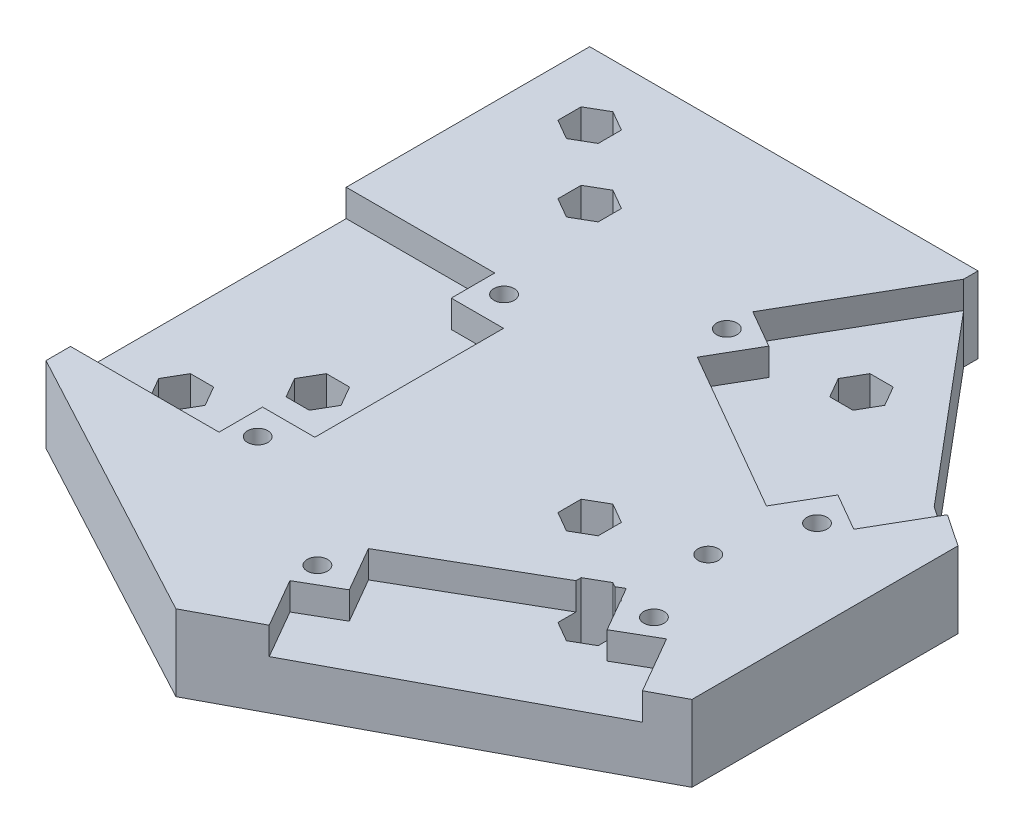
from build123d import *

# Parameters (mm, degrees)
SKETCH1_W               = 100
SKETCH1_H               = 100
BOSS_EXTRUDE1_DEPTH     = 14
SKETCH1_3_R             = 2.15
SKETCH1_3_R_2           = 2.2
BOSS_EXTRUDE2_DEPTH     = 3
BOSS_EXTRUDE3_OUTLINE_R = 1.876672924
BOSS_EXTRUDE3_DEPTH     = 14
SKETCH2_4_R             = 1.876672924
SKETCH2_4_R_2           = 1.876681549
SKETCH2_4_R_3           = 1.876676308
CUT_EXTRUDE2_DEPTH      = 102.168534459
SKETCH1_5_R             = 2.15
SKETCH1_5_R_2           = 2.2
CUT_EXTRUDE3_DEPTH      = 102.168534459
CUT_EXTRUDE4_START      = 3
SKETCH1_6_R             = 2.15
SKETCH1_6_R_2           = 2.2
CUT_EXTRUDE4_DEPTH      = 99.168534459
SKETCH4_R               = 3.5
CUT_EXTRUDE5_DEPTH      = 7
CUT_EXTRUDE6_START      = -5
CUT_EXTRUDE6_DEPTH      = 5
CUT_EXTRUDE7_DEPTH      = 102.168534459


# Read off the part's stored shape, not the designer's step: Boss-Extrude3, Cut-Extrude6
with BuildPart() as part:
    # Sketch1 → Boss-Extrude1 (new body)
    with BuildSketch(Plane(origin=(0, 0, 0), x_dir=(1, 0, 0), z_dir=(0, 1, 0))):
        Rectangle(SKETCH1_W, SKETCH1_H)
        Polygon((28.7, -27.136195996), (28.7, -22.863804004), (25, -20.727608008), (21.3, -22.863804004), (21.3, -27.136195996), (25, -29.272391992), align=None, mode=Mode.SUBTRACT)
        Polygon((27.136195996, 28.7), (22.863804004, 28.7), (20.727608008, 25), (22.863804004, 21.3), (27.136195996, 21.3), (29.272391992, 25), align=None, mode=Mode.SUBTRACT)
        Polygon((39.636195996, 33.8), (41.772391992, 37.5), (39.636195996, 41.2), (35.363804004, 41.2), (33.227608008, 37.5), (35.363804004, 33.8), align=None, mode=Mode.SUBTRACT)
        Polygon((33.8, -39.636195996), (37.5, -41.772391992), (41.2, -39.636195996), (41.2, -35.363804004), (37.5, -33.227608008), (33.8, -35.363804004), align=None, mode=Mode.SUBTRACT)
        Polygon((-27.136195996, -28.7), (-22.863804004, -28.7), (-20.727608008, -25), (-22.863804004, -21.3), (-27.136195996, -21.3), (-29.272391992, -25), align=None, mode=Mode.SUBTRACT)
        Polygon((-39.636195996, -33.8), (-41.772391992, -37.5), (-39.636195996, -41.2), (-35.363804004, -41.2), (-33.227608008, -37.5), (-35.363804004, -33.8), align=None, mode=Mode.SUBTRACT)
        Polygon((-28.7, 27.136195996), (-28.7, 22.863804004), (-25, 20.727608008), (-21.3, 22.863804004), (-21.3, 27.136195996), (-25, 29.272391992), align=None, mode=Mode.SUBTRACT)
        Polygon((-33.8, 39.636195996), (-37.5, 41.772391992), (-41.2, 39.636195996), (-41.2, 35.363804004), (-37.5, 33.227608008), (-33.8, 35.363804004), align=None, mode=Mode.SUBTRACT)
    extrude(amount=BOSS_EXTRUDE1_DEPTH)

    # Sketch1<3> → Boss-Extrude2 (add)
    # profile 1 of 8: a face of its own
    with BuildSketch(Plane(origin=(0, 0, 0), x_dir=(1, 0, 0), z_dir=(0, 1, 0))):
        Polygon((-21.3, 27.136195996), (-25, 29.272391992), (-28.7, 27.136195996), (-28.7, 22.863804004), (-25, 20.727608008), (-21.3, 22.863804004), align=None)
        with Locations(Location((-25, 25, 0), (0, 0, 270))):
            Circle(SKETCH1_3_R, mode=Mode.SUBTRACT)
    # profile 2 of 8: a face of its own
    with BuildSketch(Plane(origin=(0, 0, 0), x_dir=(1, 0, 0), z_dir=(0, 1, 0))):
        Polygon((27.136195996, 21.3), (29.272391992, 25), (27.136195996, 28.7), (22.863804004, 28.7), (20.727608008, 25), (22.863804004, 21.3), align=None)
        with Locations(Location((25, 25, 0), (0, 0, 270))):
            Circle(SKETCH1_3_R, mode=Mode.SUBTRACT)
    # profile 3 of 8: a face of its own
    with BuildSketch(Plane(origin=(0, 0, 0), x_dir=(1, 0, 0), z_dir=(0, 1, 0))):
        Polygon((-27.136195996, -21.3), (-29.272391992, -25), (-27.136195996, -28.7), (-22.863804004, -28.7), (-20.727608008, -25), (-22.863804004, -21.3), align=None)
        with Locations(Location((-25, -25, 0), (0, 0, 270))):
            Circle(SKETCH1_3_R, mode=Mode.SUBTRACT)
    # profile 4 of 8: a face of its own
    with BuildSketch(Plane(origin=(0, 0, 0), x_dir=(1, 0, 0), z_dir=(0, 1, 0))):
        Polygon((21.3, -27.136195996), (25, -29.272391992), (28.7, -27.136195996), (28.7, -22.863804004), (25, -20.727608008), (21.3, -22.863804004), align=None)
        with Locations(Location((25, -25, 0), (0, 0, 270))):
            Circle(SKETCH1_3_R, mode=Mode.SUBTRACT)
    # profile 5 of 8: a face of its own
    with BuildSketch(Plane(origin=(0, 0, 0), x_dir=(1, 0, 0), z_dir=(0, 1, 0))):
        Polygon((-37.5, 33.227608008), (-33.8, 35.363804004), (-33.8, 39.636195996), (-37.5, 41.772391992), (-41.2, 39.636195996), (-41.2, 35.363804004), align=None)
        with Locations(Location((-37.5, 37.5, 0), (0, 0, 270))):
            Circle(SKETCH1_3_R_2, mode=Mode.SUBTRACT)
    # profile 6 of 8: a face of its own
    with BuildSketch(Plane(origin=(0, 0, 0), x_dir=(1, 0, 0), z_dir=(0, 1, 0))):
        Polygon((33.227608008, 37.5), (35.363804004, 33.8), (39.636195996, 33.8), (41.772391992, 37.5), (39.636195996, 41.2), (35.363804004, 41.2), align=None)
        with Locations(Location((37.5, 37.5, 0), (0, 0, 270))):
            Circle(SKETCH1_3_R_2, mode=Mode.SUBTRACT)
    # profile 7 of 8: a face of its own
    with BuildSketch(Plane(origin=(0, 0, 0), x_dir=(1, 0, 0), z_dir=(0, 1, 0))):
        Polygon((37.5, -33.227608008), (33.8, -35.363804004), (33.8, -39.636195996), (37.5, -41.772391992), (41.2, -39.636195996), (41.2, -35.363804004), align=None)
        with Locations(Location((37.5, -37.5, 0), (0, 0, 270))):
            Circle(SKETCH1_3_R_2, mode=Mode.SUBTRACT)
    # profile 8 of 8: a face of its own
    with BuildSketch(Plane(origin=(0, 0, 0), x_dir=(1, 0, 0), z_dir=(0, 1, 0))):
        Polygon((-33.227608008, -37.5), (-35.363804004, -33.8), (-39.636195996, -33.8), (-41.772391992, -37.5), (-39.636195996, -41.2), (-35.363804004, -41.2), align=None)
        with Locations(Location((-37.5, -37.5, 0), (0, 0, 270))):
            Circle(SKETCH1_3_R_2, mode=Mode.SUBTRACT)
    extrude(amount=BOSS_EXTRUDE2_DEPTH)

    # Boss-Extrude3 outline → Boss-Extrude3 (add)
    # profile 1 of 3: a face of its own
    with BuildSketch(Plane(origin=(0, 0, 0), x_dir=(1, 0, 0), z_dir=(0, 1, 0))):
        Polygon((-50, -50), (1.49030732, -77.596125408), (63.387015123, -44.578572147), (63.387015123, 4.360488441), (50, 13.368548372), (50, -50), align=None)
        with Locations((7.56996484, -57.649113785)):
            Circle(BOSS_EXTRUDE3_OUTLINE_R, mode=Mode.SUBTRACT)
    # profile 2 of 3: a face of its own
    with BuildSketch(Plane(origin=(0, 0, 0), x_dir=(1, 0, 0), z_dir=(0, 1, 0))):
        Polygon((33.8, -35.363804004), (33.8, -39.636195996), (37.5, -41.772391992), (41.2, -39.636195996), (41.2, -35.363804004), (37.5, -33.227608008), align=None)
    # profile 3 of 3: a face of its own
    with BuildSketch(Plane(origin=(0, 0, 0), x_dir=(1, 0, 0), z_dir=(0, 1, 0))):
        Polygon((25, -29.272391992), (28.7, -27.136195996), (28.7, -22.863804004), (25, -20.727608008), (21.3, -22.863804004), (21.3, -27.136195996), align=None)
    extrude(amount=BOSS_EXTRUDE3_DEPTH)

    # Sketch2<4> → Cut-Extrude2 (cut, through all)
    with BuildSketch(Plane(origin=(0, 0, 0), x_dir=(1, 0, 0), z_dir=(0, 1, 0))):
        with Locations(Location((-18.410804318, 2.661766915, 0), (0, 0, 90))):
            Circle(SKETCH2_4_R)
        with Locations(Location((-18.410857492, -42.64912664, 0), (0, 0, 90))):
            Circle(SKETCH2_4_R_2)
        with Locations(Location((46.810335072, -4.993667335, 0), (0, 0, 90))):
            Circle(SKETCH2_4_R)
        with Locations(Location((7.569976773, 17.661825492, 0), (0, 0, 90))):
            Circle(SKETCH2_4_R_2)
        with Locations(Location((46.810376313, -34.993713059, 0), (0, 0, 90))):
            Circle(SKETCH2_4_R_2)
        with Locations(Location((41.81037924, -19.993681351, 0), (0, 0, 90))):
            Circle(SKETCH2_4_R_3)
    extrude(amount=CUT_EXTRUDE2_DEPTH, mode=Mode.SUBTRACT)

    # Sketch1<5> → Cut-Extrude3 (cut, through all)
    with BuildSketch(Plane(origin=(0, 0, 0), x_dir=(1, 0, 0), z_dir=(0, 1, 0))):
        with Locations(Location((25, -25, 0), (0, 0, 90))):
            Circle(SKETCH1_5_R)
        with Locations(Location((37.5, -37.5, 0), (0, 0, 90))):
            Circle(SKETCH1_5_R_2)
    extrude(amount=CUT_EXTRUDE3_DEPTH, mode=Mode.SUBTRACT)

    # Sketch1<6> → Cut-Extrude4 (cut, through all)
    # profile 1 of 2: a face of its own
    with BuildSketch(Plane(origin=(0, 0, 0), x_dir=(1, 0, 0), z_dir=(0, 1, 0)).offset(CUT_EXTRUDE4_START)):
        Polygon((21.3, -27.136195996), (25, -29.272391992), (28.7, -27.136195996), (28.7, -22.863804004), (25, -20.727608008), (21.3, -22.863804004), align=None)
        with Locations(Location((25, -25, 0), (0, 0, 90))):
            Circle(SKETCH1_6_R, mode=Mode.SUBTRACT)
    # profile 2 of 2: a face of its own
    with BuildSketch(Plane(origin=(0, 0, 0), x_dir=(1, 0, 0), z_dir=(0, 1, 0)).offset(CUT_EXTRUDE4_START)):
        Polygon((37.5, -33.227608008), (33.8, -35.363804004), (33.8, -39.636195996), (37.5, -41.772391992), (41.2, -39.636195996), (41.2, -35.363804004), align=None)
        with Locations(Location((37.5, -37.5, 0), (0, 0, 90))):
            Circle(SKETCH1_6_R_2, mode=Mode.SUBTRACT)
    extrude(amount=CUT_EXTRUDE4_DEPTH, mode=Mode.SUBTRACT)

    # Sketch4 → Cut-Extrude5 (cut)
    with BuildSketch(Plane.XZ):
        with Locations(Location((-18.410857492, 42.64912664, 0), (0, 0, 270))):
            Circle(SKETCH4_R)
        with Locations(Location((7.56996484, 57.649113785, 0), (0, 0, 270))):
            Circle(SKETCH4_R)
        with Locations(Location((46.810376313, 34.993713059, 0), (0, 0, 270))):
            Circle(SKETCH4_R)
        with Locations(Location((41.81037924, 19.993681351, 0), (0, 0, 270))):
            Circle(SKETCH4_R)
        with Locations(Location((46.810335072, 4.993667335, 0), (0, 0, 270))):
            Circle(SKETCH4_R)
        with Locations(Location((7.569976773, -17.661825492, 0), (0, 0, 270))):
            Circle(SKETCH4_R)
        with Locations(Location((-18.410804318, -2.661766915, 0), (0, 0, 270))):
            Circle(SKETCH4_R)
    extrude(amount=-CUT_EXTRUDE5_DEPTH, mode=Mode.SUBTRACT)

    # Cut-Extrude6 outline → Cut-Extrude6 (cut)
    # profile 1 of 4: a face of its own
    with BuildSketch(Plane(origin=(0, 14, 0), x_dir=(1, 0, 0), z_dir=(0, 1, 0)).offset(CUT_EXTRUDE6_START)):
        Polygon((33.8, -39.636195996), (33.8, -36.323061379), (9.605859336, -50.29154546), (14.416411925, -58.623672649), (7.488236991, -62.623721659), (12.684960133, -71.624563129), (57.455635846, -47.742547068), (51.407399943, -37.26690995), (44.479232222, -41.266971454), (41.2, -35.587170755), (41.2, -39.636195996), (37.5, -41.772391992), align=None)
    # profile 2 of 4: a face of its own
    with BuildSketch(Plane(origin=(0, 14, 0), x_dir=(1, 0, 0), z_dir=(0, 1, 0)).offset(CUT_EXTRUDE6_START)):
        Polygon((38.330742803, -33.707237589), (41.006558917, -35.252120743), (39.668651775, -32.934796012), align=None)
    # profile 3 of 4: a face of its own
    with BuildSketch(Plane(origin=(0, 14, 0), x_dir=(1, 0, 0), z_dir=(0, 1, 0)).offset(CUT_EXTRUDE6_START)):
        Polygon((44.231104263, 1.422809198), (51.159335789, -2.577141792), (57.465256686, 8.345212026), (50, 13.368548372), (21.429346819, 47.356544026), (7.240111214, 22.779563183), (14.168349953, 18.779624687), (9.357764576, 10.447452092), (39.420546743, -6.909315145), align=None)
        Polygon((22.863804004, 28.7), (27.136195996, 28.7), (29.272391992, 25), (27.136195996, 21.3), (22.863804004, 21.3), (20.727608008, 25), align=None, mode=Mode.SUBTRACT)
    # profile 4 of 4: a face of its own
    with BuildSketch(Plane(origin=(0, 14, 0), x_dir=(1, 0, 0), z_dir=(0, 1, 0)).offset(CUT_EXTRUDE6_START)):
        Polygon((-13.056920756, -37.493670286), (-13.056910486, -2.780153602), (-22.678020594, -2.780150755), (-22.678077186, 5.219849245), (-50, 5.219655968), (-50, -45.493909983), (-22.678015563, -45.493667439), (-22.678086581, -37.493667439), align=None)
        Polygon((-41.772391992, -37.5), (-39.636195996, -33.8), (-35.363804004, -33.8), (-33.227608008, -37.5), (-35.363804004, -41.2), (-39.636195996, -41.2), align=None, mode=Mode.SUBTRACT)
        Polygon((-22.863804004, -28.7), (-27.136195996, -28.7), (-29.272391992, -25), (-27.136195996, -21.3), (-22.863804004, -21.3), (-20.727608008, -25), align=None, mode=Mode.SUBTRACT)
    extrude(amount=CUT_EXTRUDE6_DEPTH, mode=Mode.SUBTRACT)

    # Sketch3<3> → Cut-Extrude7 (cut, through all)
    with BuildSketch(Plane(origin=(0, 14, 0), x_dir=(1, 0, 0), z_dir=(0, 1, 0))):
        Polygon((21.429346819, 47.356544026), (30.121399502, 42.338181641), (34.544955417, 50), (21.429346819, 50), align=None)
        Polygon((34.544955417, 50), (30.121399502, 42.338181641), (50, 30.86125845), (56.102157177, 27.338173954), (64.602161533, 42.060603303), (38.621403858, 57.06061099), align=None)
        Polygon((50, 30.86125845), (30.121399502, 42.338181641), (21.429346819, 47.356544026), (50, 13.368548372), align=None)
    extrude(amount=-CUT_EXTRUDE7_DEPTH, mode=Mode.SUBTRACT)


solid = part.part
